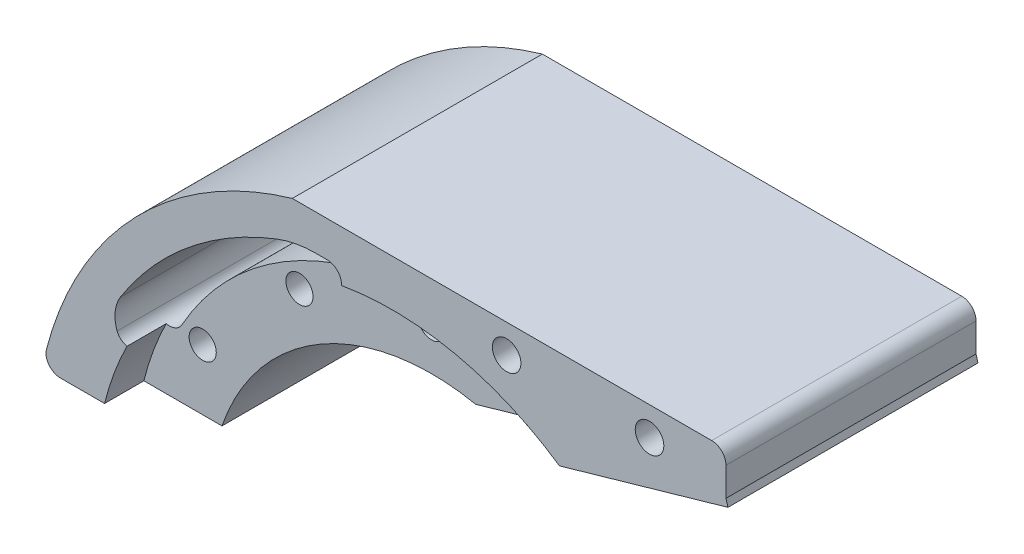
from build123d import *
from build123d.topology import SkipClean

# Parameters (mm, degrees)
SKETCH_1_R          = 1.9
SKETCH_1_R_2        = 2
EXTRUDE_1_DEPTH     = 35
EXTRUDE_2_DEPTH     = 35
CUT_EXTRUDE_1_DEPTH = 118.156356153
SKETCH_4_R          = 41.5
CUT_EXTRUDE_2_DEPTH = 5.5
SKETCH_5_R          = 31
CUT_EXTRUDE_3_DEPTH = 116.632442624
SKETCH_6_R          = 2
CUT_EXTRUDE_4_DEPTH = 90
EXTRUDE_3_DEPTH     = 35
FILLET_1_R          = 15
FILLET_2_R          = 5
FILLET_3_R          = 2
CUT_EXTRUDE_START   = -5.5
CUT_EXTRUDE_5_DEPTH = 5.5
EXTRUDE_START       = 5.5
SKETCH_9_R          = 1.9
EXTRUDE_4_DEPTH     = 5.5


with BuildPart() as part:
    # 草图1 → 凸台-拉伸1 (new body)
    with BuildSketch(Plane.XY):
        with BuildLine():
            Line((-46.419972715, 26.434696638), (-100.702636481, 42))
            Line((-100.702636481, 42), (-100.702636481, 48))
            Line((-100.702636481, 48), (100.702636481, 48))
            Line((100.702636481, 48), (100.702636481, 42))
            Line((100.702636481, 42), (46.419972715, 26.434696638))
            ThreePointArc((46.419972715, 26.434696638), (35.478614393, 20.327525063), (28.382623085, 10))
            Line((28.382623085, 10), (-28.382623085, 10))
            ThreePointArc((-28.382623085, 10), (-35.478614393, 20.327525063), (-46.419972715, 26.434696638))
        make_face()
        with Locations((-54, 37)):
            Circle(SKETCH_1_R, mode=Mode.SUBTRACT)
        with Locations((-35.5, 32.04293994)):
            Circle(SKETCH_1_R, mode=Mode.SUBTRACT)
        with Locations((-21.95706006, 18.5)):
            Circle(SKETCH_1_R, mode=Mode.SUBTRACT)
        with Locations(Location((21.95706006, 18.5, 0), (0, 0, 180))):
            Circle(SKETCH_1_R, mode=Mode.SUBTRACT)
        with Locations(Location((35.5, 32.04293994, 0), (0, 0, 180))):
            Circle(SKETCH_1_R, mode=Mode.SUBTRACT)
        with Locations(Location((54, 37, 0), (0, 0, 180))):
            Circle(SKETCH_1_R, mode=Mode.SUBTRACT)
        with Locations((-90, 44)):
            Circle(SKETCH_1_R_2, mode=Mode.SUBTRACT)
        with Locations((-70, 44)):
            Circle(SKETCH_1_R_2, mode=Mode.SUBTRACT)
        with Locations(Location((70, 44, 0), (0, 0, 180))):
            Circle(SKETCH_1_R_2, mode=Mode.SUBTRACT)
        with Locations(Location((90, 44, 0), (0, 0, 180))):
            Circle(SKETCH_1_R_2, mode=Mode.SUBTRACT)
    extrude(amount=EXTRUDE_1_DEPTH)

    # 草图2 → 凸台-拉伸2 (add)
    with BuildSketch(Plane.XY.offset(35)):
        Polygon((-100.702636481, 42), (-100.978273837, 41.038738304), (-67.334114479, 31.39143085), (-67.058477124, 32.352692546), align=None)
        Polygon((67.058477124, 32.352692546), (100.702636481, 42), (100.978273837, 41.038738304), (67.334114479, 31.39143085), align=None)
    extrude(amount=-EXTRUDE_2_DEPTH)

    # 草图3 → 切除-拉伸1 (cut, through all)
    with BuildSketch(Plane.XY.offset(35)):
        with BuildLine():
            Line((-6.641746516, 40.210125207), (-15.476556882, 19.658485028))
            ThreePointArc((-15.476556882, 19.658485028), (-17.211519663, 18.450985714), (-19.06092662, 19.474628401))
            ThreePointArc((-19.06092662, 19.474628401), (-30.09691848, 32.072460053), (-45.323396591, 39.047619048))
            ThreePointArc((-45.323396591, 39.047619048), (-46.877626016, 41.21821789), (-44.889566421, 43))
            Line((-44.889566421, 43), (-8.479162585, 43))
            ThreePointArc((-8.479162585, 43), (-6.808870756, 42.100056911), (-6.641746516, 40.210125207))
        make_face()
        with BuildLine():
            Line((-10.837416069, 17.789874793), (-1.837416069, 38.725781047))
            ThreePointArc((-1.837416069, 38.725781047), (0, 39.935906254), (1.837416069, 38.725781047))
            Line((1.837416069, 38.725781047), (10.837416069, 17.789874793))
            ThreePointArc((10.837416069, 17.789874793), (10.670291829, 15.899943089), (9, 15))
            Line((9, 15), (-9, 15))
            ThreePointArc((-9, 15), (-10.670291829, 15.899943089), (-10.837416069, 17.789874793))
        make_face()
        with BuildLine():
            Line((44.889566421, 43), (8.479162585, 43))
            ThreePointArc((8.479162585, 43), (6.808870756, 42.100056911), (6.641746516, 40.210125207))
            Line((6.641746516, 40.210125207), (15.476556882, 19.658485028))
            ThreePointArc((15.476556882, 19.658485028), (17.211519663, 18.450985714), (19.06092662, 19.474628401))
            ThreePointArc((19.06092662, 19.474628401), (30.09691848, 32.072460053), (45.323396591, 39.047619048))
            ThreePointArc((45.323396591, 39.047619048), (46.877626016, 41.21821789), (44.889566421, 43))
        make_face()
    extrude(amount=-CUT_EXTRUDE_1_DEPTH, mode=Mode.SUBTRACT)

    # 草图4 → 切除-拉伸2 (cut)
    with BuildSketch(Plane(origin=(0, 0, 0), x_dir=(-1, 0, 0), z_dir=(0, 0, -1))):
        with Locations((54, 0)):
            Circle(SKETCH_4_R)
        with Locations((-54, 0)):
            Circle(SKETCH_4_R)
    extrude(amount=-CUT_EXTRUDE_2_DEPTH, mode=Mode.SUBTRACT)

    # 草图5 → 切除-拉伸3 (cut, through all)
    with BuildSketch(Plane(origin=(0, 0, 5.5), x_dir=(-1, 0, 0), z_dir=(0, 0, -1))):
        with Locations((-54, 0)):
            Circle(SKETCH_5_R)
        with Locations((54, 0)):
            Circle(SKETCH_5_R)
    extrude(amount=-CUT_EXTRUDE_3_DEPTH, mode=Mode.SUBTRACT)

    # 草图6 → 切除-拉伸4 (cut)
    # profile 1 of 2: a face of its own
    with BuildSketch(Plane(origin=(0, 0, 0), x_dir=(-1, 0, 0), z_dir=(0, 0, -1))):
        with BuildLine():
            Line((112.236741432, 87.655163383), (-13.983884749, 87.655163383))
            Line((-13.983884749, 87.655163383), (-42.229785629, 48.594876825))
            ThreePointArc((-42.229785629, 48.594876825), (-41.111460254, 48.310304731), (-40, 48))
            Line((-40, 48), (100.702636481, 48))
            Line((100.702636481, 48), (100.702636481, 42))
            Line((100.702636481, 42), (100.978273837, 41.038738304))
            Line((100.978273837, 41.038738304), (77.395846699, 34.276586137))
            ThreePointArc((77.395846699, 34.276586137), (62.786203664, 40.559248331), (46.886301002, 40.88575897))
            ThreePointArc((46.886301002, 40.88575897), (46.343609415, 42.373229395), (44.889566421, 43))
            Line((44.889566421, 43), (8.479162585, 43))
            ThreePointArc((8.479162585, 43), (6.808870756, 42.100056911), (6.641746516, 40.210125207))
            Line((6.641746516, 40.210125207), (15.476556882, 19.658485028))
            ThreePointArc((15.476556882, 19.658485028), (16.027458608, 18.917059445), (16.852775325, 18.502261995))
            ThreePointArc((16.852775325, 18.502261995), (15.05508847, 14.336801105), (13.722835254, 10))
            Line((13.722835254, 10), (-5.010205144, 10))
            ThreePointArc((-5.010205144, 10), (-4.25319235, 5.0254481), (-4, 0))
            Line((-4, 0), (108.733946442, 6.013095543))
            Line((108.733946442, 6.013095543), (112.236741432, 87.655163383))
        make_face()
    # profile 2 of 2: a face of its own
    with BuildSketch(Plane(origin=(0, 0, 0), x_dir=(-1, 0, 0), z_dir=(0, 0, -1))):
        with BuildLine():
            Line((100.702636481, 48), (-40, 48))
            ThreePointArc((-40, 48), (-34.085108298, 45.862807246), (-28.485298356, 43))
            Line((-28.485298356, 43), (-8.479162585, 43))
            ThreePointArc((-8.479162585, 43), (-6.808870756, 42.100056911), (-6.641746516, 40.210125207))
            Line((-6.641746516, 40.210125207), (-12.159497891, 27.374666815))
            ThreePointArc((-12.159497891, 27.374666815), (-10.524900739, 24.696472303), (-9.061502157, 21.921026701))
            Line((-9.061502157, 21.921026701), (-1.837416069, 38.725781047))
            ThreePointArc((-1.837416069, 38.725781047), (0, 39.935906254), (1.837416069, 38.725781047))
            Line((1.837416069, 38.725781047), (10.837416069, 17.789874793))
            ThreePointArc((10.837416069, 17.789874793), (10.670291829, 15.899943089), (9, 15))
            Line((9, 15), (-6.303039929, 15))
            ThreePointArc((-6.303039929, 15), (-5.592023957, 12.516703058), (-5.010205144, 10))
            Line((-5.010205144, 10), (13.722835254, 10))
            ThreePointArc((13.722835254, 10), (15.05508847, 14.336801105), (16.852775325, 18.502261995))
            ThreePointArc((16.852775325, 18.502261995), (16.027458608, 18.917059445), (15.476556882, 19.658485028))
            Line((15.476556882, 19.658485028), (6.641746516, 40.210125207))
            ThreePointArc((6.641746516, 40.210125207), (6.808870756, 42.100056911), (8.479162585, 43))
            Line((8.479162585, 43), (44.889566421, 43))
            ThreePointArc((44.889566421, 43), (46.343609415, 42.373229395), (46.886301002, 40.88575897))
            ThreePointArc((46.886301002, 40.88575897), (62.786203664, 40.559248331), (77.395846699, 34.276586137))
            Line((77.395846699, 34.276586137), (100.978273837, 41.038738304))
            Line((100.978273837, 41.038738304), (100.702636481, 42))
            Line((100.702636481, 42), (100.702636481, 48))
        make_face()
        with Locations((70, 44)):
            Circle(SKETCH_6_R, mode=Mode.SUBTRACT)
        with Locations((90, 44)):
            Circle(SKETCH_6_R, mode=Mode.SUBTRACT)
    extrude(amount=-CUT_EXTRUDE_4_DEPTH, mode=Mode.SUBTRACT)

    # 草图7 → 凸台-拉伸3 (add)
    with SkipClean():  # the faces are left unmerged after this step: merging them gives an invalid solid
        with BuildSketch(Plane(origin=(0, 0, 0), x_dir=(-1, 0, 0), z_dir=(0, 0, -1))):
            with BuildLine():
                ThreePointArc((-5.010205144, 10), (-13.25714787, 28.983098529), (-28.485298356, 43))
                Line((-28.485298356, 43), (-40.733500839, 43))
                ThreePointArc((-40.733500839, 43), (-21.007081908, 30.601754129), (-10.125178063, 10))
                Line((-10.125178063, 10), (-5.010205144, 10))
            make_face()
        extrude(amount=-EXTRUDE_3_DEPTH)

    # 圆角1
    fillet_1_edges = [part.edges().sort_by_distance(p)[0] for p in [
        (40.733500839, 43, 17.5),
    ]]
    fillet(fillet_1_edges, radius=FILLET_1_R)

    # 圆角2
    # the kernel refuses this fillet: 5 mm, written as the material it adds along each edge
    with BuildSketch(Plane(origin=(14.589674395, 21.72156154, 35), x_dir=(0.3949373965823167, -0.9187080345685357, 0), z_dir=(0, 0, -1))) as fillet_2_piece_1:
        with BuildLine():
            CenterArc((2.541917953, -4.991213508), FILLET_2_R, 93.397222659, 52.136727531)
            ThreePointArc((-1.580390366, -2.16162447), (-0.806277224, -1.069054456), (0, 0))
            Line((0, 0), (2.245628028, 0))
        make_face()
    extrude(amount=35)

    # 圆角3
    fillet_3_edges = [part.edges().sort_by_distance(p)[0] for p in [
        (100.702636481, 48, 17.5),
        (5.010205144, 10, 17.5),
    ]]
    fillet(fillet_3_edges, radius=FILLET_3_R)

    # 草图8 → 切除-拉伸5 (cut)
    with BuildSketch(Plane.XY.offset(35).offset(CUT_EXTRUDE_START)):
        with BuildLine():
            Line((60.174750934, 30.378815825), (67.058477124, 32.352692546))
            Line((67.058477124, 32.352692546), (67.334114479, 31.39143085))
            Line((67.334114479, 31.39143085), (77.395846699, 34.276586137))
            ThreePointArc((77.395846699, 34.276586137), (62.786203664, 40.559248331), (46.886301002, 40.88575897))
            ThreePointArc((46.886301002, 40.88575897), (46.413246455, 39.704469547), (45.323396591, 39.047619048))
            ThreePointArc((45.323396591, 39.047619048), (30.09691848, 32.072460053), (19.06092662, 19.474628401))
            ThreePointArc((19.06092662, 19.474628401), (18.119991721, 18.61796813), (16.852775325, 18.502261995))
            ThreePointArc((16.852775325, 18.502261995), (15.05508847, 14.336801105), (13.722835254, 10))
            Line((13.722835254, 10), (24.657198498, 10))
            ThreePointArc((24.657198498, 10), (38.572308164, 26.888405022), (60.174750934, 30.378815825))
        make_face()
    extrude(amount=CUT_EXTRUDE_5_DEPTH, mode=Mode.SUBTRACT)

    # 草图9 → 凸台-拉伸4 (add)
    with BuildSketch(Plane(origin=(0, 0, 5.5), x_dir=(-1, 0, 0), z_dir=(0, 0, -1)).offset(EXTRUDE_START)):
        with BuildLine():
            Line((-67.058477124, 32.352692546), (-60.174750934, 30.378815825))
            ThreePointArc((-60.174750934, 30.378815825), (-38.572308164, 26.888405022), (-24.657198498, 10))
            Line((-24.657198498, 10), (-13.722835254, 10))
            ThreePointArc((-13.722835254, 10), (-15.05508847, 14.336801105), (-16.852775325, 18.502261995))
            ThreePointArc((-16.852775325, 18.502261995), (-18.119991721, 18.61796813), (-19.06092662, 19.474628401))
            ThreePointArc((-19.06092662, 19.474628401), (-30.09691848, 32.072460053), (-45.323396591, 39.047619048))
            ThreePointArc((-45.323396591, 39.047619048), (-46.413246455, 39.704469547), (-46.886301002, 40.88575897))
            ThreePointArc((-46.886301002, 40.88575897), (-62.786203664, 40.559248331), (-77.395846699, 34.276586137))
            Line((-77.395846699, 34.276586137), (-67.334114479, 31.39143085))
            Line((-67.334114479, 31.39143085), (-67.058477124, 32.352692546))
        make_face()
        with Locations(Location((-54, 37, 0), (0, 0, 180))):
            Circle(SKETCH_9_R, mode=Mode.SUBTRACT)
        with Locations(Location((-35.5, 32.04293994, 0), (0, 0, 180))):
            Circle(SKETCH_9_R, mode=Mode.SUBTRACT)
        with Locations(Location((-21.95706006, 18.5, 0), (0, 0, 180))):
            Circle(SKETCH_9_R, mode=Mode.SUBTRACT)
    extrude(amount=-EXTRUDE_4_DEPTH)


solid = part.part
